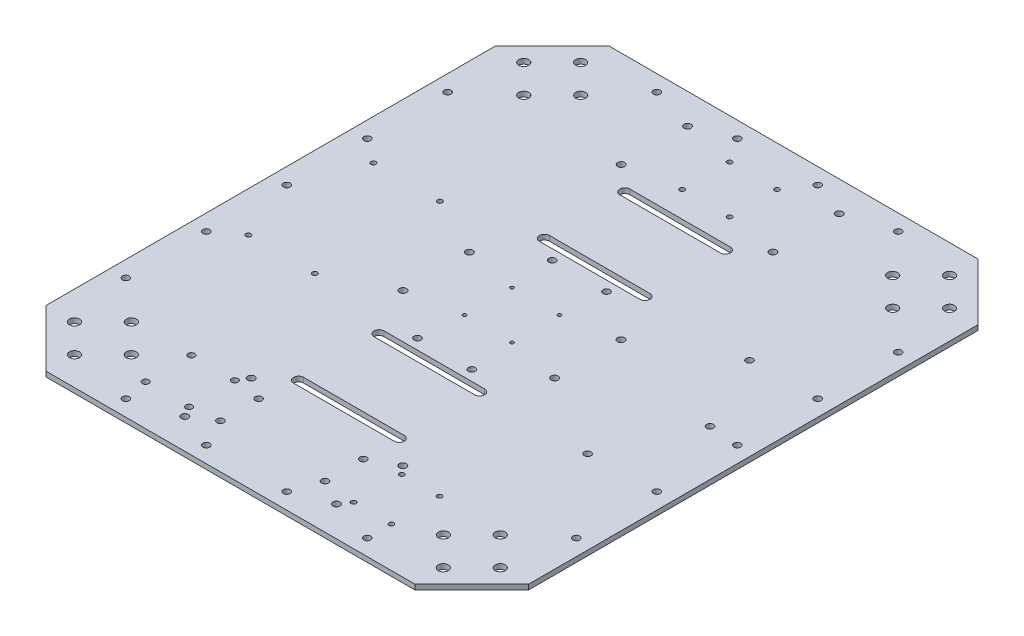
from build123d import *

# Parameters (mm, degrees)
SKETCH1_R               = 2.2225
BOSS_EXTRUDE1_DEPTH     = 3.175
SKETCH2_R               = 2.159
CUT_EXTRUDE1_DEPTH      = 297.247830215
CUT_EXTRUDE2_DEPTH      = 297.247830215
SKETCH7_R               = 1.524
CUT_EXTRUDE3_DEPTH      = 297.247830215
CUT_EXTRUDE4_DEPTH      = 297.247830215
CUT_EXTRUDE4_DEPTH_BACK = 297.247830215
SKETCH8_R               = 1.524
SKETCH9_R               = 2.032
CUT_EXTRUDE5_DEPTH      = 297.247830215
SKETCH10_R              = 2.159
CUT_EXTRUDE6_DEPTH      = 297.247830215
SKETCH12_R              = 1.575
CUT_EXTRUDE7_DEPTH      = 297.247830215
SKETCH13_R              = 1.1
CUT_EXTRUDE8_DEPTH      = 297.247830215
SKETCH14_R              = 3.175
CUT_EXTRUDE9_DEPTH      = 297.247830215
SKETCH15_R              = 2.159
CUT_EXTRUDE10_DEPTH     = 297.247830215
SKETCH16_R              = 2.159
CUT_EXTRUDE11_DEPTH     = 297.247830215


with BuildPart() as part:
    # Sketch1 → Boss-Extrude1 (new body)
    with BuildSketch(Plane(origin=(0, 0, 0), x_dir=(1, 0, 0), z_dir=(0, 1, 0))):
        Polygon((-85.365028143, 123.058976948), (-121.286052627, 87.137952464), (-121.286052627, -196.619998567), (-85.365028143, -232.541023052), (147.592922888, -232.541023052), (183.513947373, -196.619998567), (183.513947373, 87.137952464), (147.592922888, 123.058976948), align=None)
        with Locations((-16.765052627, -213.491023052)):
            Circle(SKETCH1_R, mode=Mode.SUBTRACT)
        with Locations((-16.765052627, -171.581023052)):
            Circle(SKETCH1_R, mode=Mode.SUBTRACT)
        with Locations((-16.765052627, -75.696023052)):
            Circle(SKETCH1_R, mode=Mode.SUBTRACT)
        with Locations((78.992947373, -213.491023052)):
            Circle(SKETCH1_R, mode=Mode.SUBTRACT)
        with Locations((78.992947373, -171.581023052)):
            Circle(SKETCH1_R, mode=Mode.SUBTRACT)
        with Locations((78.992947373, -75.696023052)):
            Circle(SKETCH1_R, mode=Mode.SUBTRACT)
        with Locations((-16.765052627, -33.786023052)):
            Circle(SKETCH1_R, mode=Mode.SUBTRACT)
        with Locations((-16.765052627, 62.098976948)):
            Circle(SKETCH1_R, mode=Mode.SUBTRACT)
        with Locations((-16.765052627, 104.008976948)):
            Circle(SKETCH1_R, mode=Mode.SUBTRACT)
        with Locations((78.992947373, -33.786023052)):
            Circle(SKETCH1_R, mode=Mode.SUBTRACT)
        with Locations((78.992947373, 62.098976948)):
            Circle(SKETCH1_R, mode=Mode.SUBTRACT)
        with Locations((78.992947373, 104.008976948)):
            Circle(SKETCH1_R, mode=Mode.SUBTRACT)
    extrude(amount=BOSS_EXTRUDE1_DEPTH)

    # Sketch2 → Cut-Extrude1 (cut, through all)
    with BuildSketch(Plane(origin=(0, 3.175, 0), x_dir=(1, 0, 0), z_dir=(0, 1, 0))):
        with Locations((13.841947373, -12.069023052)):
            Circle(SKETCH2_R)
        with Locations((48.131947373, -12.069023052)):
            Circle(SKETCH2_R)
        with Locations((13.841947373, -97.159023052)):
            Circle(SKETCH2_R)
        with Locations((48.131947373, -97.159023052)):
            Circle(SKETCH2_R)
    extrude(amount=-CUT_EXTRUDE1_DEPTH, mode=Mode.SUBTRACT)

    # Sketch4 → Cut-Extrude2 (cut, through all)
    with BuildSketch(Plane(origin=(0, 3.175, 0), x_dir=(1, 0, 0), z_dir=(0, 1, 0))):
        with BuildLine():
            Line((-0.636052627, 51.430976948), (62.863947373, 51.430976948))
            ThreePointArc((62.863947373, 51.430976948), (66.038947373, 48.255976948), (62.863947373, 45.080976948))
            Line((62.863947373, 45.080976948), (-0.636052627, 45.080976948))
            ThreePointArc((-0.636052627, 45.080976948), (-3.811052627, 48.255976948), (-0.636052627, 51.430976948))
        make_face()
        with BuildLine():
            Line((-0.636052627, 0.630976948), (62.863947373, 0.630976948))
            ThreePointArc((62.863947373, 0.630976948), (66.038947373, -2.544023052), (62.863947373, -5.719023052))
            Line((62.863947373, -5.719023052), (-0.636052627, -5.719023052))
            ThreePointArc((-0.636052627, -5.719023052), (-3.811052627, -2.544023052), (-0.636052627, 0.630976948))
        make_face()
        with BuildLine():
            Line((-0.636052627, -110.113023052), (62.863947373, -110.113023052))
            ThreePointArc((62.863947373, -110.113023052), (66.038947373, -106.938023052), (62.863947373, -103.763023052))
            Line((62.863947373, -103.763023052), (-0.636052627, -103.763023052))
            ThreePointArc((-0.636052627, -103.763023052), (-3.811052627, -106.938023052), (-0.636052627, -110.113023052))
        make_face()
        with BuildLine():
            Line((-0.636052627, -160.913023052), (62.863947373, -160.913023052))
            ThreePointArc((62.863947373, -160.913023052), (66.038947373, -157.738023052), (62.863947373, -154.563023052))
            Line((62.863947373, -154.563023052), (-0.636052627, -154.563023052))
            ThreePointArc((-0.636052627, -154.563023052), (-3.811052627, -157.738023052), (-0.636052627, -160.913023052))
        make_face()
    extrude(amount=-CUT_EXTRUDE2_DEPTH, mode=Mode.SUBTRACT)

    # Sketch7 → Cut-Extrude3 (cut, through all)
    with BuildSketch(Plane(origin=(0, 3.175, 0), x_dir=(1, 0, 0), z_dir=(0, 1, 0))):
        with Locations((16.127947373, 67.686976948)):
            Circle(SKETCH7_R)
        with Locations((46.099947373, 67.686976948)):
            Circle(SKETCH7_R)
        with Locations((16.127947373, 97.658976948)):
            Circle(SKETCH7_R)
        with Locations((46.099947373, 97.658976948)):
            Circle(SKETCH7_R)
    extrude(amount=-CUT_EXTRUDE3_DEPTH, mode=Mode.SUBTRACT)

    # Sketch8 → Cut-Extrude4 (cut, two sides: drawn at the far end of the back side and taken through both)
    with BuildSketch(Plane(origin=(0, 3.175, 0), x_dir=(1, 0, 0), z_dir=(0, 1, 0)).offset(-CUT_EXTRUDE4_DEPTH_BACK)):
        with Locations((83.437947373, -207.141023052)):
            Circle(SKETCH8_R)
        with Locations((83.437947373, -176.661023052)):
            Circle(SKETCH8_R)
        with Locations((107.313947373, -207.141023052)):
            Circle(SKETCH8_R)
        with Locations((107.313947373, -176.661023052)):
            Circle(SKETCH8_R)
    extrude(amount=CUT_EXTRUDE4_DEPTH + CUT_EXTRUDE4_DEPTH_BACK, mode=Mode.SUBTRACT)

    # Sketch9 → Cut-Extrude5 (cut, through all)
    with BuildSketch(Plane(origin=(0, 0, 0), x_dir=(-1, 0, 0), z_dir=(0, -1, 0))):
        with Locations((48.134052627, -206.887023052)):
            Circle(SKETCH9_R)
        with Locations((20.702052627, -206.887023052)):
            Circle(SKETCH9_R)
        with Locations((48.134052627, -177.931023052)):
            Circle(SKETCH9_R)
        with Locations((20.702052627, -177.931023052)):
            Circle(SKETCH9_R)
    extrude(amount=-CUT_EXTRUDE5_DEPTH, mode=Mode.SUBTRACT)

    # Sketch10 → Cut-Extrude6 (cut, through all)
    with BuildSketch(Plane.XZ):
        with Locations((-3.176052627, 204.601023052)):
            Circle(SKETCH10_R)
        with Locations((62.863947373, 204.601023052)):
            Circle(SKETCH10_R)
        with Locations((-3.176052627, 180.471023052)):
            Circle(SKETCH10_R)
        with Locations((62.863947373, 180.471023052)):
            Circle(SKETCH10_R)
    extrude(amount=-CUT_EXTRUDE6_DEPTH, mode=Mode.SUBTRACT)

    # Sketch12 → Cut-Extrude7 (cut, through all)
    with BuildSketch(Plane.XZ):
        with Locations((-95.886052627, 94.216023052)):
            Circle(SKETCH12_R)
        with Locations((-95.886052627, 15.266023052)):
            Circle(SKETCH12_R)
        with Locations((-53.936052627, 15.266023052)):
            Circle(SKETCH12_R)
        with Locations((-53.936052627, 94.216023052)):
            Circle(SKETCH12_R)
    extrude(amount=-CUT_EXTRUDE7_DEPTH, mode=Mode.SUBTRACT)

    # Sketch13 → Cut-Extrude8 (cut, through all)
    with BuildSketch(Plane.XZ):
        with Locations((16.113947373, 69.741023052)):
            Circle(SKETCH13_R)
        with Locations((16.113947373, 39.741023052)):
            Circle(SKETCH13_R)
        with Locations((46.113947373, 39.741023052)):
            Circle(SKETCH13_R)
        with Locations((46.113947373, 69.741023052)):
            Circle(SKETCH13_R)
    extrude(amount=-CUT_EXTRUDE8_DEPTH, mode=Mode.SUBTRACT)

    # Sketch14 → Cut-Extrude9 (cut, through all)
    with BuildSketch(Plane.XZ):
        with Locations((-103.325540385, 196.619998567)):
            Circle(SKETCH14_R)
        with Locations((-85.365028143, 214.580510809)):
            Circle(SKETCH14_R)
        with Locations((-85.365028143, 178.659486325)):
            Circle(SKETCH14_R)
        with Locations((-67.404515901, 196.619998567)):
            Circle(SKETCH14_R)
        with Locations((129.632410646, 196.619998567)):
            Circle(SKETCH14_R)
        with Locations((147.592922888, 178.659486325)):
            Circle(SKETCH14_R)
        with Locations((165.55343513, 196.619998567)):
            Circle(SKETCH14_R)
        with Locations((147.592922888, 214.580510809)):
            Circle(SKETCH14_R)
        with Locations((-85.365028143, -105.098464706)):
            Circle(SKETCH14_R)
        with Locations((-103.325540385, -87.137952464)):
            Circle(SKETCH14_R)
        with Locations((-85.365028143, -69.177440222)):
            Circle(SKETCH14_R)
        with Locations((-67.404515901, -87.137952464)):
            Circle(SKETCH14_R)
        with Locations((165.55343513, -87.137952464)):
            Circle(SKETCH14_R)
        with Locations((147.592922888, -69.177440222)):
            Circle(SKETCH14_R)
        with Locations((147.592922888, -105.098464706)):
            Circle(SKETCH14_R)
        with Locations((129.632410646, -87.137952464)):
            Circle(SKETCH14_R)
    extrude(amount=-CUT_EXTRUDE9_DEPTH, mode=Mode.SUBTRACT)

    # Sketch15 → Cut-Extrude10 (cut, through all)
    with BuildSketch(Plane.XZ):
        with Locations((5.713947373, 222.381023052)):
            Circle(SKETCH15_R)
        with Locations((-45.086052627, 222.381023052)):
            Circle(SKETCH15_R)
        with Locations((-111.126052627, 54.741023052)):
            Circle(SKETCH15_R)
        with Locations((-111.126052627, 105.541023052)):
            Circle(SKETCH15_R)
        with Locations((-111.126052627, 156.341023052)):
            Circle(SKETCH15_R)
        with Locations((173.353947373, 156.341023052)):
            Circle(SKETCH15_R)
        with Locations((173.353947373, 105.541023052)):
            Circle(SKETCH15_R)
        with Locations((173.353947373, 54.741023052)):
            Circle(SKETCH15_R)
        with Locations((107.313947373, 222.381023052)):
            Circle(SKETCH15_R)
        with Locations((56.513947373, 222.381023052)):
            Circle(SKETCH15_R)
        with Locations((56.513947373, -112.898976948)):
            Circle(SKETCH15_R)
        with Locations((107.313947373, -112.898976948)):
            Circle(SKETCH15_R)
        with Locations((173.353947373, 3.941023052)):
            Circle(SKETCH15_R)
        with Locations((173.353947373, -46.858976948)):
            Circle(SKETCH15_R)
        with Locations((-111.126052627, -46.858976948)):
            Circle(SKETCH15_R)
        with Locations((-111.126052627, 3.941023052)):
            Circle(SKETCH15_R)
        with Locations((-45.086052627, -112.898976948)):
            Circle(SKETCH15_R)
        with Locations((5.713947373, -112.898976948)):
            Circle(SKETCH15_R)
    extrude(amount=-CUT_EXTRUDE10_DEPTH, mode=Mode.SUBTRACT)

    # Sketch16 → Cut-Extrude11 (cut, through all)
    with BuildSketch(Plane(origin=(0, 0, 0), x_dir=(-1, 0, 0), z_dir=(0, -1, 0))):
        with Locations((-130.865574362, -106.679409794)):
            Circle(SKETCH16_R)
        with Locations((-130.865574362, -4.529409794)):
            Circle(SKETCH16_R)
        with Locations((-154.465574362, -53.029409794)):
            Circle(SKETCH16_R)
    extrude(amount=-CUT_EXTRUDE11_DEPTH, mode=Mode.SUBTRACT)


solid = part.part
